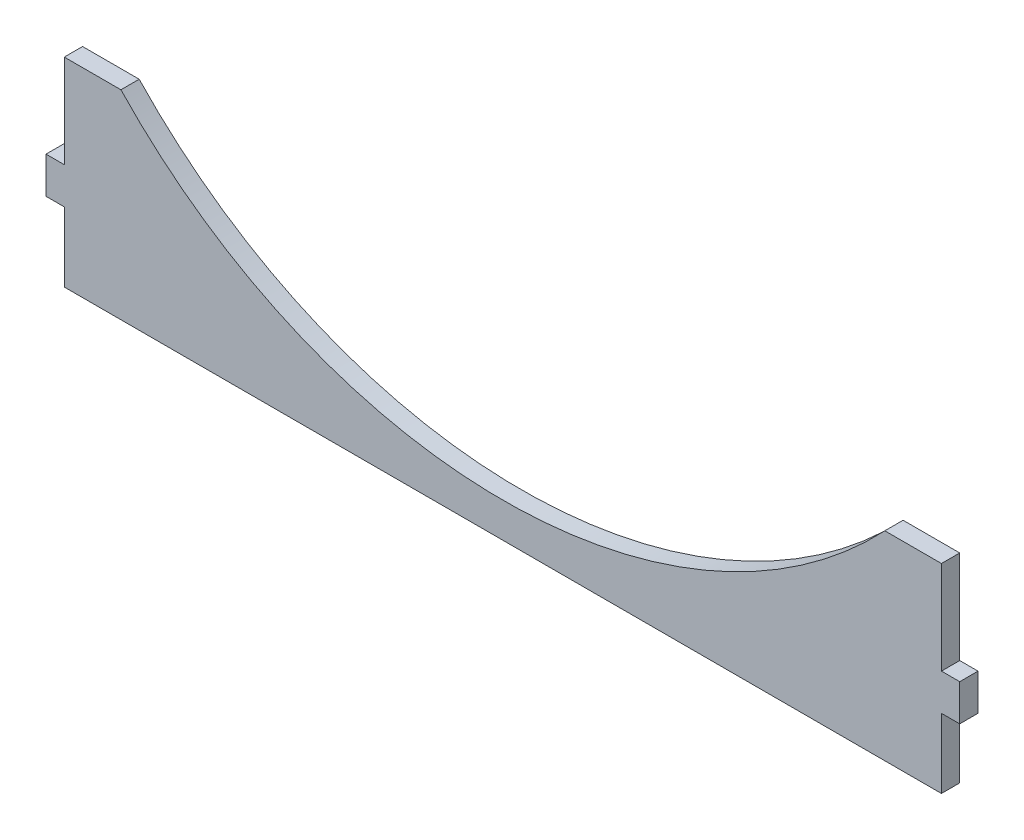
from build123d import *

# Parameters (mm, degrees)
BOSS_EXTRU_1_DEPTH = 5


with BuildPart() as part:
    # Esquisse1 → Boss.-Extru.1 (new body)
    with BuildSketch(Plane.XY):
        with BuildLine():
            Line((0, 0), (-15.5, 0))
            Line((-15.5, 0), (-15.5, -25.5))
            Line((-15.5, -25.5), (-20.5, -25.5))
            Line((-20.5, -25.5), (-20.5, -35.5))
            Line((-20.5, -35.5), (-15.5, -35.5))
            Line((-15.5, -35.5), (-15.5, -54.5))
            Line((-15.5, -54.5), (224.5, -54.5))
            Line((224.5, -54.5), (224.5, -35.5))
            Line((224.5, -35.5), (229.5, -35.5))
            Line((229.5, -35.5), (229.5, -25.5))
            Line((229.5, -25.5), (224.5, -25.5))
            Line((224.5, -25.5), (224.5, 0))
            Line((224.5, 0), (209, 0))
            ThreePointArc((209, 0), (104.5, -45), (0, 0))
        make_face()
    extrude(amount=BOSS_EXTRU_1_DEPTH)


solid = part.part
